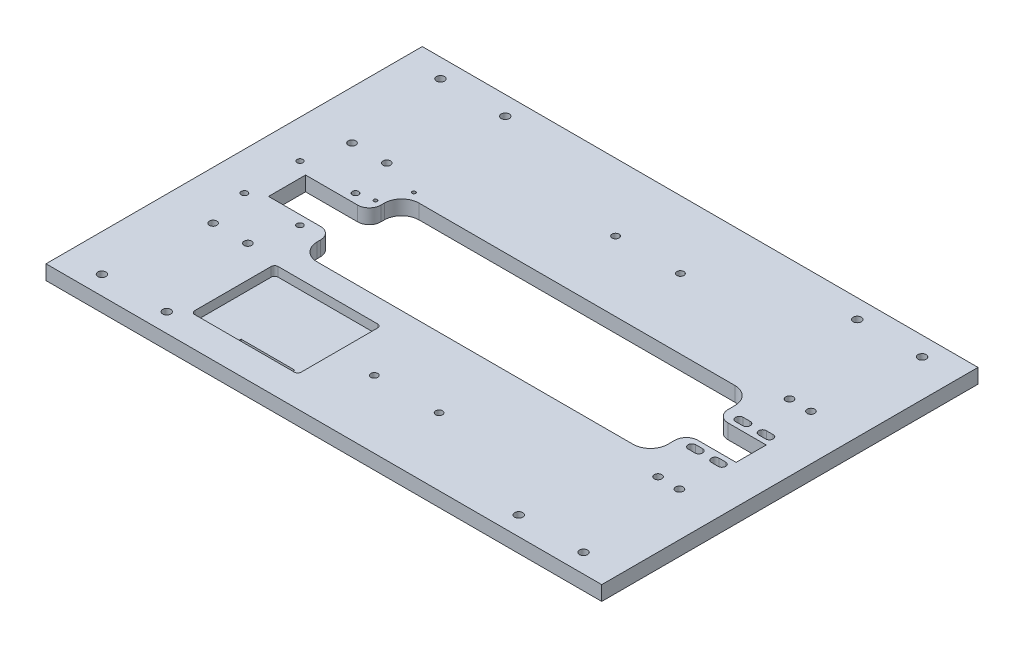
from build123d import *

# Parameters (mm, degrees)
SKETCH1_W                      = 480
SKETCH1_H                      = 325
BOSS_EXTRUDE1_DEPTH            = 12.6
CUT_EXTRUDE1_REACH             = 292.112
SKETCH2_R                      = 3
CUT_EXTRUDE2_REACH             = 292.112
FILLET1_R                      = 10
CUT_EXTRUDE3_REACH             = 292.112
SKETCH4_R                      = 2.618497629
SKETCH4_R_2                    = 2.7
SKETCH4_R_3                    = 2.5
SKETCH4_R_4                    = 3.25
FILLET2_R                      = 10
SKETCH5_R                      = 3.25
CUT_EXTRUDE4_DEPTH             = 2
CUT_EXTRUDE5_REACH             = 292.112
SKETCH5_2_R                    = 3.25
CUT_EXTRUDE6_REACH             = 292.112
CUT_EXTRUDE6_DIRECTION_2_DEPTH = 2
CUT_EXTRUDE7_REACH             = 292.112
SKETCH7_R                      = 2.25
SKETCH8_R                      = 3.5
CUT_EXTRUDE8_DEPTH             = 6
CUT_EXTRUDE9_DEPTH             = 8
CUT_EXTRUDE10_REACH            = 291.949
SKETCH10_W                     = 46.435426172
SKETCH10_H                     = 7
CUT_EXTRUDE11_REACH            = 292.112
SKETCH12_R                     = 1.5
FILLET3_R                      = 15


with BuildPart() as part:
    # Sketch1 → Boss-Extrude1 (new body)
    with BuildSketch(Plane(origin=(0, 0, 0), x_dir=(1, 0, 0), z_dir=(0, 1, 0))):
        Rectangle(SKETCH1_W, SKETCH1_H)
    extrude(amount=BOSS_EXTRUDE1_DEPTH)

    # Sketch2 → Cut-Extrude1 (cut, up to next)
    with BuildSketch(Plane.XZ, mode=Mode.PRIVATE) as cut_extrude1_sk1:
        with Locations((41.247428317, -104.2)):
            Circle(SKETCH2_R)
    cut_extrude1_tool1 = extrude(cut_extrude1_sk1.sketch, amount=-CUT_EXTRUDE1_REACH, mode=Mode.PRIVATE) & part.part
    # Sketch2 → Cut-Extrude1 (cut, up to next)
    with BuildSketch(Plane.XZ, mode=Mode.PRIVATE) as cut_extrude1_sk2:
        with Locations((-14.752571683, -104.2)):
            Circle(SKETCH2_R)
    cut_extrude1_tool2 = extrude(cut_extrude1_sk2.sketch, amount=-CUT_EXTRUDE1_REACH, mode=Mode.PRIVATE) & part.part
    # Sketch2 → Cut-Extrude1 (cut, up to next)
    with BuildSketch(Plane.XZ, mode=Mode.PRIVATE) as cut_extrude1_sk3:
        with Locations((41.247428317, 104.2)):
            Circle(SKETCH2_R)
    cut_extrude1_tool3 = extrude(cut_extrude1_sk3.sketch, amount=-CUT_EXTRUDE1_REACH, mode=Mode.PRIVATE) & part.part
    # Sketch2 → Cut-Extrude1 (cut, up to next)
    with BuildSketch(Plane.XZ, mode=Mode.PRIVATE) as cut_extrude1_sk4:
        with Locations((-14.752571683, 104.2)):
            Circle(SKETCH2_R)
    cut_extrude1_tool4 = extrude(cut_extrude1_sk4.sketch, amount=-CUT_EXTRUDE1_REACH, mode=Mode.PRIVATE) & part.part
    add(cut_extrude1_tool1.solids().sort_by_distance((41.247428, 0, -104.2))[0], mode=Mode.SUBTRACT)
    add(cut_extrude1_tool2.solids().sort_by_distance((-14.752572, 0, -104.2))[0], mode=Mode.SUBTRACT)
    add(cut_extrude1_tool3.solids().sort_by_distance((41.247428, 0, 104.2))[0], mode=Mode.SUBTRACT)
    add(cut_extrude1_tool4.solids().sort_by_distance((-14.752572, 0, 104.2))[0], mode=Mode.SUBTRACT)

    # Sketch3 → Cut-Extrude2 (cut, up to next)
    with BuildSketch(Plane.XZ, mode=Mode.PRIVATE) as cut_extrude2_sk1:
        Polygon((163.584746975, 44), (-139.288669968, 44), (-139.288669968, 16), (-194.288669968, 16), (-194.288669968, -16), (-139.288669968, -16), (-139.288669968, -44), (163.584746975, -44), (163.584746975, -13), (206.584746975, -13), (206.584746975, 13), (163.584746975, 13), align=None)
    cut_extrude2_tool1 = extrude(cut_extrude2_sk1.sketch, amount=-CUT_EXTRUDE2_REACH, mode=Mode.PRIVATE) & part.part
    add(cut_extrude2_tool1.solids().sort_by_distance((8.030808, 0, 0))[0], mode=Mode.SUBTRACT)

    # Fillet1
    fillet1_edges = [part.edges().sort_by_distance(p)[0] for p in [
        (-139.288669968, 6.3, 16),
        (-139.288669968, 6.3, -16),
    ]]
    fillet(fillet1_edges, radius=FILLET1_R)

    # Sketch4 → Cut-Extrude3 (cut, up to next)
    with BuildSketch(Plane.XZ, mode=Mode.PRIVATE) as cut_extrude3_sk1:
        with Locations((-159.175714853, 24)):
            Circle(SKETCH4_R)
    cut_extrude3_tool1 = extrude(cut_extrude3_sk1.sketch, amount=-CUT_EXTRUDE3_REACH, mode=Mode.PRIVATE) & part.part
    # Sketch4 → Cut-Extrude3 (cut, up to next)
    with BuildSketch(Plane.XZ, mode=Mode.PRIVATE) as cut_extrude3_sk2:
        with Locations((-207.175714853, 24)):
            Circle(SKETCH4_R_2)
    cut_extrude3_tool2 = extrude(cut_extrude3_sk2.sketch, amount=-CUT_EXTRUDE3_REACH, mode=Mode.PRIVATE) & part.part
    # Sketch4 → Cut-Extrude3 (cut, up to next)
    with BuildSketch(Plane.XZ, mode=Mode.PRIVATE) as cut_extrude3_sk3:
        with Locations((-207.175714853, -24)):
            Circle(SKETCH4_R_3)
    cut_extrude3_tool3 = extrude(cut_extrude3_sk3.sketch, amount=-CUT_EXTRUDE3_REACH, mode=Mode.PRIVATE) & part.part
    # Sketch4 → Cut-Extrude3 (cut, up to next)
    with BuildSketch(Plane.XZ, mode=Mode.PRIVATE) as cut_extrude3_sk4:
        with Locations((-159.175714853, -24)):
            Circle(SKETCH4_R_2)
    cut_extrude3_tool4 = extrude(cut_extrude3_sk4.sketch, amount=-CUT_EXTRUDE3_REACH, mode=Mode.PRIVATE) & part.part
    # Sketch4 → Cut-Extrude3 (cut, up to next)
    with BuildSketch(Plane.XZ, mode=Mode.PRIVATE) as cut_extrude3_sk5:
        with Locations((-168.175714853, -60.002723044)):
            Circle(SKETCH4_R_4)
    cut_extrude3_tool5 = extrude(cut_extrude3_sk5.sketch, amount=-CUT_EXTRUDE3_REACH, mode=Mode.PRIVATE) & part.part
    # Sketch4 → Cut-Extrude3 (cut, up to next)
    with BuildSketch(Plane.XZ, mode=Mode.PRIVATE) as cut_extrude3_sk6:
        with Locations((-198.175714853, -60.002723044)):
            Circle(SKETCH4_R_4)
    cut_extrude3_tool6 = extrude(cut_extrude3_sk6.sketch, amount=-CUT_EXTRUDE3_REACH, mode=Mode.PRIVATE) & part.part
    # Sketch4 → Cut-Extrude3 (cut, up to next)
    with BuildSketch(Plane.XZ, mode=Mode.PRIVATE) as cut_extrude3_sk7:
        with Locations((-168.175714853, 60)):
            Circle(SKETCH4_R_4)
    cut_extrude3_tool7 = extrude(cut_extrude3_sk7.sketch, amount=-CUT_EXTRUDE3_REACH, mode=Mode.PRIVATE) & part.part
    # Sketch4 → Cut-Extrude3 (cut, up to next)
    with BuildSketch(Plane.XZ, mode=Mode.PRIVATE) as cut_extrude3_sk8:
        with Locations((-198.175714853, 60)):
            Circle(SKETCH4_R_4)
    cut_extrude3_tool8 = extrude(cut_extrude3_sk8.sketch, amount=-CUT_EXTRUDE3_REACH, mode=Mode.PRIVATE) & part.part
    add(cut_extrude3_tool1.solids().sort_by_distance((-159.175715, 0, 24))[0], mode=Mode.SUBTRACT)
    add(cut_extrude3_tool2.solids().sort_by_distance((-207.175715, 0, 24))[0], mode=Mode.SUBTRACT)
    add(cut_extrude3_tool3.solids().sort_by_distance((-207.175715, 0, -24))[0], mode=Mode.SUBTRACT)
    add(cut_extrude3_tool4.solids().sort_by_distance((-159.175715, 0, -24))[0], mode=Mode.SUBTRACT)
    add(cut_extrude3_tool5.solids().sort_by_distance((-168.175715, 0, -60.002723))[0], mode=Mode.SUBTRACT)
    add(cut_extrude3_tool6.solids().sort_by_distance((-198.175715, 0, -60.002723))[0], mode=Mode.SUBTRACT)
    add(cut_extrude3_tool7.solids().sort_by_distance((-168.175715, 0, 60))[0], mode=Mode.SUBTRACT)
    add(cut_extrude3_tool8.solids().sort_by_distance((-198.175715, 0, 60))[0], mode=Mode.SUBTRACT)

    # Fillet2
    fillet2_edges = [part.edges().sort_by_distance(p)[0] for p in [
        (163.584746975, 6.3, -13),
        (163.584746975, 6.3, 13),
    ]]
    fillet(fillet2_edges, radius=FILLET2_R)

    # Sketch5 → Cut-Extrude4 (cut)
    with BuildSketch(Plane.XZ):
        with Locations((183.62480094, 57.5)):
            Circle(SKETCH5_R)
        with Locations((202.135280509, 57.5)):
            Circle(SKETCH5_R)
        with Locations((200.716342035, -57.5)):
            Circle(SKETCH5_R)
        with Locations((182.205862466, -57.5)):
            Circle(SKETCH5_R)
    extrude(amount=-CUT_EXTRUDE4_DEPTH, mode=Mode.SUBTRACT)

    # Sketch5<2> → Cut-Extrude5 (cut, up to next)
    with BuildSketch(Plane.XZ, mode=Mode.PRIVATE) as cut_extrude5_sk1:
        with Locations((183.62480094, 57.5)):
            Circle(SKETCH5_2_R)
    cut_extrude5_tool1 = extrude(cut_extrude5_sk1.sketch, amount=-CUT_EXTRUDE5_REACH, mode=Mode.PRIVATE) & part.part
    # Sketch5<2> → Cut-Extrude5 (cut, up to next)
    with BuildSketch(Plane.XZ, mode=Mode.PRIVATE) as cut_extrude5_sk2:
        with Locations((202.135280509, 57.5)):
            Circle(SKETCH5_2_R)
    cut_extrude5_tool2 = extrude(cut_extrude5_sk2.sketch, amount=-CUT_EXTRUDE5_REACH, mode=Mode.PRIVATE) & part.part
    # Sketch5<2> → Cut-Extrude5 (cut, up to next)
    with BuildSketch(Plane.XZ, mode=Mode.PRIVATE) as cut_extrude5_sk3:
        with Locations((200.716342035, -57.5)):
            Circle(SKETCH5_2_R)
    cut_extrude5_tool3 = extrude(cut_extrude5_sk3.sketch, amount=-CUT_EXTRUDE5_REACH, mode=Mode.PRIVATE) & part.part
    # Sketch5<2> → Cut-Extrude5 (cut, up to next)
    with BuildSketch(Plane.XZ, mode=Mode.PRIVATE) as cut_extrude5_sk4:
        with Locations((182.205862466, -57.5)):
            Circle(SKETCH5_2_R)
    cut_extrude5_tool4 = extrude(cut_extrude5_sk4.sketch, amount=-CUT_EXTRUDE5_REACH, mode=Mode.PRIVATE) & part.part
    add(cut_extrude5_tool1.solids().sort_by_distance((183.624801, 0, 57.5))[0], mode=Mode.SUBTRACT)
    add(cut_extrude5_tool2.solids().sort_by_distance((202.135281, 0, 57.5))[0], mode=Mode.SUBTRACT)
    add(cut_extrude5_tool3.solids().sort_by_distance((200.716342, 0, -57.5))[0], mode=Mode.SUBTRACT)
    add(cut_extrude5_tool4.solids().sort_by_distance((182.205862, 0, -57.5))[0], mode=Mode.SUBTRACT)

    # Sketch6 → Cut-Extrude6 (cut, up to next)
    with BuildSketch(Plane.XZ, mode=Mode.PRIVATE) as cut_extrude6_sk1:
        with BuildLine():
            Line((201.864098655, -23.75), (195.864098655, -23.75))
            ThreePointArc((195.864098655, -23.75), (192.614098655, -20.5), (195.864098655, -17.25))
            Line((195.864098655, -17.25), (201.864098655, -17.25))
            ThreePointArc((201.864098655, -17.25), (205.114098655, -20.5), (201.864098655, -23.75))
        make_face()
    cut_extrude6_tool1 = extrude(cut_extrude6_sk1.sketch, amount=-CUT_EXTRUDE6_REACH, mode=Mode.PRIVATE) & part.part
    # Sketch6 → Cut-Extrude6 (cut, up to next)
    with BuildSketch(Plane.XZ, mode=Mode.PRIVATE) as cut_extrude6_sk2:
        with BuildLine():
            Line((201.864098655, 17.25), (195.864098655, 17.25))
            ThreePointArc((195.864098655, 17.25), (192.614098655, 20.5), (195.864098655, 23.75))
            Line((195.864098655, 23.75), (201.864098655, 23.75))
            ThreePointArc((201.864098655, 23.75), (205.114098655, 20.5), (201.864098655, 17.25))
        make_face()
    cut_extrude6_tool2 = extrude(cut_extrude6_sk2.sketch, amount=-CUT_EXTRUDE6_REACH, mode=Mode.PRIVATE) & part.part
    # Sketch6 → Cut-Extrude6 (cut, up to next)
    with BuildSketch(Plane.XZ, mode=Mode.PRIVATE) as cut_extrude6_sk3:
        with BuildLine():
            Line((181.864098655, 17.25), (175.864098655, 17.25))
            ThreePointArc((175.864098655, 17.25), (172.614098655, 20.5), (175.864098655, 23.75))
            Line((175.864098655, 23.75), (181.864098655, 23.75))
            ThreePointArc((181.864098655, 23.75), (185.114098655, 20.5), (181.864098655, 17.25))
        make_face()
    cut_extrude6_tool3 = extrude(cut_extrude6_sk3.sketch, amount=-CUT_EXTRUDE6_REACH, mode=Mode.PRIVATE) & part.part
    # Sketch6 → Cut-Extrude6 (cut, up to next)
    with BuildSketch(Plane.XZ, mode=Mode.PRIVATE) as cut_extrude6_sk4:
        with BuildLine():
            Line((175.864098655, -23.75), (182.011171344, -23.75))
            ThreePointArc((182.011171344, -23.75), (185.261171344, -20.5), (182.011171344, -17.25))
            Line((182.011171344, -17.25), (175.864098655, -17.25))
            ThreePointArc((175.864098655, -17.25), (172.614098655, -20.5), (175.864098655, -23.75))
        make_face()
    cut_extrude6_tool4 = extrude(cut_extrude6_sk4.sketch, amount=-CUT_EXTRUDE6_REACH, mode=Mode.PRIVATE) & part.part
    add(cut_extrude6_tool1.solids().sort_by_distance((198.864099, 0, -20.5))[0], mode=Mode.SUBTRACT)
    add(cut_extrude6_tool2.solids().sort_by_distance((198.864099, 0, 20.5))[0], mode=Mode.SUBTRACT)
    add(cut_extrude6_tool3.solids().sort_by_distance((178.864099, 0, 20.5))[0], mode=Mode.SUBTRACT)
    add(cut_extrude6_tool4.solids().sort_by_distance((178.937635, 0, -20.5))[0], mode=Mode.SUBTRACT)

    # Sketch6 → Cut-Extrude6 direction 2 (cut)
    with BuildSketch(Plane.XZ):
        with BuildLine():
            Line((201.864098655, -23.75), (195.864098655, -23.75))
            ThreePointArc((195.864098655, -23.75), (192.614098655, -20.5), (195.864098655, -17.25))
            Line((195.864098655, -17.25), (201.864098655, -17.25))
            ThreePointArc((201.864098655, -17.25), (205.114098655, -20.5), (201.864098655, -23.75))
        make_face()
        with BuildLine():
            Line((201.864098655, 17.25), (195.864098655, 17.25))
            ThreePointArc((195.864098655, 17.25), (192.614098655, 20.5), (195.864098655, 23.75))
            Line((195.864098655, 23.75), (201.864098655, 23.75))
            ThreePointArc((201.864098655, 23.75), (205.114098655, 20.5), (201.864098655, 17.25))
        make_face()
        with BuildLine():
            Line((181.864098655, 17.25), (175.864098655, 17.25))
            ThreePointArc((175.864098655, 17.25), (172.614098655, 20.5), (175.864098655, 23.75))
            Line((175.864098655, 23.75), (181.864098655, 23.75))
            ThreePointArc((181.864098655, 23.75), (185.114098655, 20.5), (181.864098655, 17.25))
        make_face()
        with BuildLine():
            Line((175.864098655, -23.75), (182.011171344, -23.75))
            ThreePointArc((182.011171344, -23.75), (185.261171344, -20.5), (182.011171344, -17.25))
            Line((182.011171344, -17.25), (175.864098655, -17.25))
            ThreePointArc((175.864098655, -17.25), (172.614098655, -20.5), (175.864098655, -23.75))
        make_face()
    extrude(amount=CUT_EXTRUDE6_DIRECTION_2_DEPTH, mode=Mode.SUBTRACT)

    # Sketch7 → Cut-Extrude7 (cut, up to next)
    with BuildSketch(Plane(origin=(0, 12.6, 0), x_dir=(1, 0, 0), z_dir=(0, 1, 0)), mode=Mode.PRIVATE) as cut_extrude7_sk1:
        with Locations((208, -146.2)):
            Circle(SKETCH7_R)
    cut_extrude7_tool1 = extrude(cut_extrude7_sk1.sketch, amount=-CUT_EXTRUDE7_REACH, mode=Mode.PRIVATE) & part.part
    # Sketch7 → Cut-Extrude7 (cut, up to next)
    with BuildSketch(Plane(origin=(0, 12.6, 0), x_dir=(1, 0, 0), z_dir=(0, 1, 0)), mode=Mode.PRIVATE) as cut_extrude7_sk2:
        with Locations((152, -146.2)):
            Circle(SKETCH7_R)
    cut_extrude7_tool2 = extrude(cut_extrude7_sk2.sketch, amount=-CUT_EXTRUDE7_REACH, mode=Mode.PRIVATE) & part.part
    # Sketch7 → Cut-Extrude7 (cut, up to next)
    with BuildSketch(Plane(origin=(0, 12.6, 0), x_dir=(1, 0, 0), z_dir=(0, 1, 0)), mode=Mode.PRIVATE) as cut_extrude7_sk3:
        with Locations((-152, -146.2)):
            Circle(SKETCH7_R)
    cut_extrude7_tool3 = extrude(cut_extrude7_sk3.sketch, amount=-CUT_EXTRUDE7_REACH, mode=Mode.PRIVATE) & part.part
    # Sketch7 → Cut-Extrude7 (cut, up to next)
    with BuildSketch(Plane(origin=(0, 12.6, 0), x_dir=(1, 0, 0), z_dir=(0, 1, 0)), mode=Mode.PRIVATE) as cut_extrude7_sk4:
        with Locations((-208, -146.2)):
            Circle(SKETCH7_R)
    cut_extrude7_tool4 = extrude(cut_extrude7_sk4.sketch, amount=-CUT_EXTRUDE7_REACH, mode=Mode.PRIVATE) & part.part
    # Sketch7 → Cut-Extrude7 (cut, up to next)
    with BuildSketch(Plane(origin=(0, 12.6, 0), x_dir=(1, 0, 0), z_dir=(0, 1, 0)), mode=Mode.PRIVATE) as cut_extrude7_sk5:
        with Locations((-208, 146.2)):
            Circle(SKETCH7_R)
    cut_extrude7_tool5 = extrude(cut_extrude7_sk5.sketch, amount=-CUT_EXTRUDE7_REACH, mode=Mode.PRIVATE) & part.part
    # Sketch7 → Cut-Extrude7 (cut, up to next)
    with BuildSketch(Plane(origin=(0, 12.6, 0), x_dir=(1, 0, 0), z_dir=(0, 1, 0)), mode=Mode.PRIVATE) as cut_extrude7_sk6:
        with Locations((-152, 146.2)):
            Circle(SKETCH7_R)
    cut_extrude7_tool6 = extrude(cut_extrude7_sk6.sketch, amount=-CUT_EXTRUDE7_REACH, mode=Mode.PRIVATE) & part.part
    # Sketch7 → Cut-Extrude7 (cut, up to next)
    with BuildSketch(Plane(origin=(0, 12.6, 0), x_dir=(1, 0, 0), z_dir=(0, 1, 0)), mode=Mode.PRIVATE) as cut_extrude7_sk7:
        with Locations((208, 146.2)):
            Circle(SKETCH7_R)
    cut_extrude7_tool7 = extrude(cut_extrude7_sk7.sketch, amount=-CUT_EXTRUDE7_REACH, mode=Mode.PRIVATE) & part.part
    # Sketch7 → Cut-Extrude7 (cut, up to next)
    with BuildSketch(Plane(origin=(0, 12.6, 0), x_dir=(1, 0, 0), z_dir=(0, 1, 0)), mode=Mode.PRIVATE) as cut_extrude7_sk8:
        with Locations((152, 146.2)):
            Circle(SKETCH7_R)
    cut_extrude7_tool8 = extrude(cut_extrude7_sk8.sketch, amount=-CUT_EXTRUDE7_REACH, mode=Mode.PRIVATE) & part.part
    add(cut_extrude7_tool1.solids().sort_by_distance((208, 12.6, 146.2))[0], mode=Mode.SUBTRACT)
    add(cut_extrude7_tool2.solids().sort_by_distance((152, 12.6, 146.2))[0], mode=Mode.SUBTRACT)
    add(cut_extrude7_tool3.solids().sort_by_distance((-152, 12.6, 146.2))[0], mode=Mode.SUBTRACT)
    add(cut_extrude7_tool4.solids().sort_by_distance((-208, 12.6, 146.2))[0], mode=Mode.SUBTRACT)
    add(cut_extrude7_tool5.solids().sort_by_distance((-208, 12.6, -146.2))[0], mode=Mode.SUBTRACT)
    add(cut_extrude7_tool6.solids().sort_by_distance((-152, 12.6, -146.2))[0], mode=Mode.SUBTRACT)
    add(cut_extrude7_tool7.solids().sort_by_distance((208, 12.6, -146.2))[0], mode=Mode.SUBTRACT)
    add(cut_extrude7_tool8.solids().sort_by_distance((152, 12.6, -146.2))[0], mode=Mode.SUBTRACT)

    # Sketch8 → Cut-Extrude8 (cut)
    with BuildSketch(Plane(origin=(0, 12.6, 0), x_dir=(1, 0, 0), z_dir=(0, 1, 0))):
        with Locations((208, 146.2)):
            Circle(SKETCH8_R)
        with Locations((152, 146.2)):
            Circle(SKETCH8_R)
        with Locations((-152, 146.2)):
            Circle(SKETCH8_R)
        with Locations((-208, 146.2)):
            Circle(SKETCH8_R)
        with Locations((208, -146.2)):
            Circle(SKETCH8_R)
        with Locations((152, -146.2)):
            Circle(SKETCH8_R)
        with Locations((-208, -146.2)):
            Circle(SKETCH8_R)
        with Locations((-152, -146.2)):
            Circle(SKETCH8_R)
    extrude(amount=-CUT_EXTRUDE8_DEPTH, mode=Mode.SUBTRACT)

    # Sketch9 → Cut-Extrude9 (cut)
    with BuildSketch(Plane(origin=(0, 12.6, 0), x_dir=(1, 0, 0), z_dir=(0, 1, 0))):
        with BuildLine():
            Line((-137.738585948, -64.277994944), (-51.738585948, -64.277994944))
            ThreePointArc((-51.738585948, -64.277994944), (-49.617265604, -65.156674601), (-48.738585948, -67.277994944))
            Line((-48.738585948, -67.277994944), (-48.738585948, -133.277994944))
            ThreePointArc((-48.738585948, -133.277994944), (-49.617265604, -135.399315288), (-51.738585948, -136.277994944))
            Line((-51.738585948, -136.277994944), (-137.738585948, -136.277994944))
            ThreePointArc((-137.738585948, -136.277994944), (-139.859906291, -135.399315288), (-140.738585948, -133.277994944))
            Line((-140.738585948, -133.277994944), (-140.738585948, -67.277994944))
            ThreePointArc((-140.738585948, -67.277994944), (-139.859906291, -65.156674601), (-137.738585948, -64.277994944))
        make_face()
    extrude(amount=-CUT_EXTRUDE9_DEPTH, mode=Mode.SUBTRACT)

    # Sketch10 → Cut-Extrude10 (cut, up to next)
    with BuildSketch(Plane(origin=(0, 4.6, 0), x_dir=(1, 0, 0), z_dir=(0, 1, 0)), mode=Mode.PRIVATE) as cut_extrude10_sk1:
        with Locations((-84.166449654, -130.120684117)):
            Rectangle(SKETCH10_W, SKETCH10_H)
    cut_extrude10_tool1 = extrude(cut_extrude10_sk1.sketch, amount=-CUT_EXTRUDE10_REACH, mode=Mode.PRIVATE) & part.part
    add(cut_extrude10_tool1.solids().sort_by_distance((-84.16645, 4.6, 130.120684))[0], mode=Mode.SUBTRACT)

    # Sketch12 → Cut-Extrude11 (cut, up to next)
    with BuildSketch(Plane.XZ, mode=Mode.PRIVATE) as cut_extrude11_sk1:
        with Locations((-145.098644241, -27.142001554)):
            Circle(SKETCH12_R)
    cut_extrude11_tool1 = extrude(cut_extrude11_sk1.sketch, amount=-CUT_EXTRUDE11_REACH, mode=Mode.PRIVATE) & part.part
    # Sketch12 → Cut-Extrude11 (cut, up to next)
    with BuildSketch(Plane.XZ, mode=Mode.PRIVATE) as cut_extrude11_sk2:
        with Locations((-134.498644241, -49.742001554)):
            Circle(SKETCH12_R)
    cut_extrude11_tool2 = extrude(cut_extrude11_sk2.sketch, amount=-CUT_EXTRUDE11_REACH, mode=Mode.PRIVATE) & part.part
    add(cut_extrude11_tool1.solids().sort_by_distance((-145.098644, 0, -27.142002))[0], mode=Mode.SUBTRACT)
    add(cut_extrude11_tool2.solids().sort_by_distance((-134.498644, 0, -49.742002))[0], mode=Mode.SUBTRACT)

    # Fillet3
    fillet3_edges = [part.edges().sort_by_distance(p)[0] for p in [
        (163.584746975, 6.3, 44),
        (163.584746975, 6.3, -44),
        (-139.288669968, 6.3, 44),
        (-139.288669968, 6.3, -44),
    ]]
    fillet(fillet3_edges, radius=FILLET3_R)


solid = part.part
